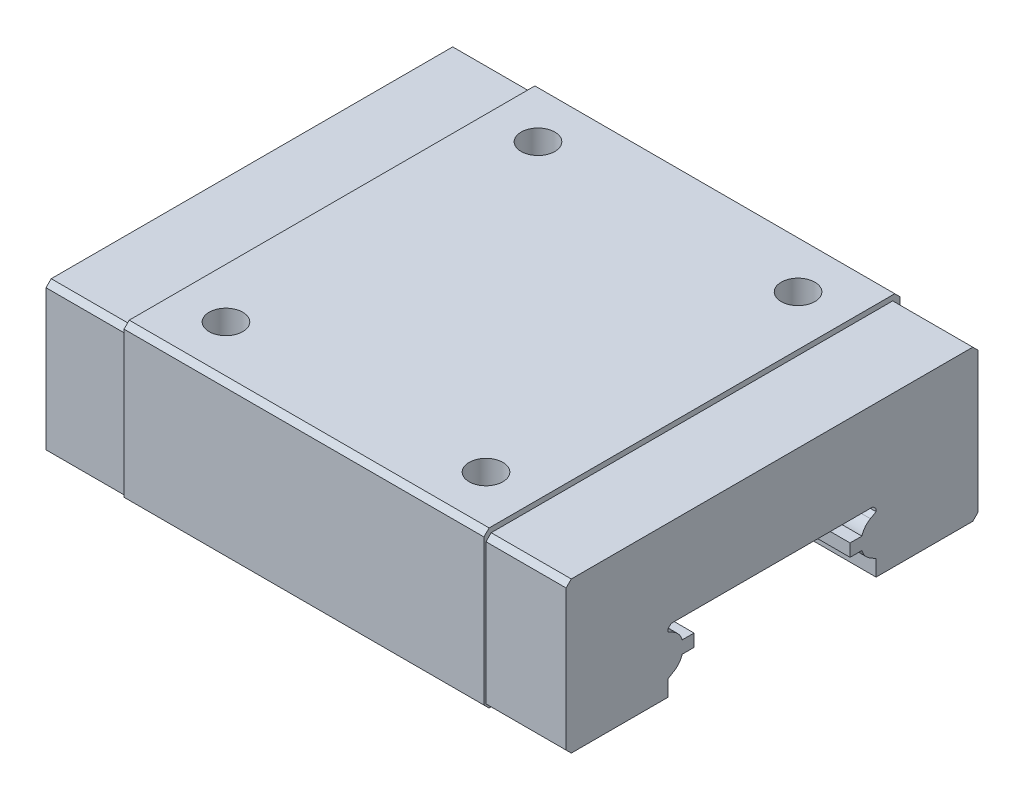
from build123d import *

# Parameters (mm, degrees)
SKETCH1_W               = 39.6
SKETCH1_H               = 14.5
BOSS_EXTRUDE1_DEPTH     = 25
SKETCH2_W               = 40
SKETCH2_H               = 15
BOSS_EXTRUDE2_DEPTH     = 17.3
CUT_EXTRUDE2_DEPTH      = 38.749172176
CUT_EXTRUDE2_DEPTH_BACK = 38.749172176
CHAMFER1_SIZE           = 0.5
CHAMFER2_SIZE           = 0.5
CHAMFER3_SIZE           = 0.5
CHAMFER4_SIZE           = 0.5
LPATTERN2_COUNT         = 2
LPATTERN2_PITCH         = 25
LPATTERN2_COUNT_DIR2    = 2
LPATTERN2_PITCH_DIR2    = 30


with BuildPart() as part:
    # Sketch1 → Boss-Extrude1 (new, symmetric)
    with BuildSketch(Plane(origin=(0, 0, 0), x_dir=(0, 0, -1), z_dir=(1, 0, 0))):
        with Locations((0, 12.25)):
            Rectangle(SKETCH1_W, SKETCH1_H)
    extrude(amount=BOSS_EXTRUDE1_DEPTH, both=True)

    # Sketch2 → Boss-Extrude2 (add, symmetric)
    with BuildSketch(Plane(origin=(0, 0, 0), x_dir=(0, 0, -1), z_dir=(1, 0, 0))):
        with Locations((0, 12.5)):
            Rectangle(SKETCH2_W, SKETCH2_H)
    extrude(amount=BOSS_EXTRUDE2_DEPTH, both=True)

    # Sketch4 → Cut-Extrude2 (cut, two sides: drawn at the far end of the back side and taken through both)
    with BuildSketch(Plane(origin=(0, 0, 0), x_dir=(0, 0, -1), z_dir=(1, 0, 0)).offset(-CUT_EXTRUDE2_DEPTH_BACK)):
        with BuildLine():
            Line((-9.7, 11), (9.7, 11))
            Line((9.7, 11), (10, 10.7))
            Line((10, 10.7), (10, 10.451039482))
            Line((10, 10.451039482), (9.455259378, 10.141421591))
            ThreePointArc((9.455259378, 10.141421591), (8.943868436, 9.701092928), (8.637115571, 9.1))
            Line((8.637115571, 9.1), (7.5, 9.1))
            Line((7.5, 9.1), (7.5, 7.9))
            Line((7.5, 7.9), (8.64, 7.9))
            ThreePointArc((8.64, 7.9), (8.939788863, 7.314120259), (9.434780564, 6.880401858))
            Line((9.434780564, 6.880401858), (10, 6.548960518))
            Line((10, 6.548960518), (10, 0))
            Line((10, 0), (-10, 0))
            Line((-10, 0), (-10, 6.548960518))
            Line((-10, 6.548960518), (-9.434780564, 6.880401858))
            ThreePointArc((-9.434780564, 6.880401858), (-8.939788863, 7.314120259), (-8.64, 7.9))
            Line((-8.64, 7.9), (-7.5, 7.9))
            Line((-7.5, 7.9), (-7.5, 9.1))
            Line((-7.5, 9.1), (-8.637115571, 9.1))
            ThreePointArc((-8.637115571, 9.1), (-8.943868436, 9.701092928), (-9.455259378, 10.141421591))
            Line((-9.455259378, 10.141421591), (-10, 10.451039482))
            Line((-10, 10.451039482), (-10, 10.7))
            Line((-10, 10.7), (-9.7, 11))
        make_face()
    extrude(amount=CUT_EXTRUDE2_DEPTH + CUT_EXTRUDE2_DEPTH_BACK, mode=Mode.SUBTRACT)

    # Chamfer1
    chamfer1_edges = [part.edges().sort_by_distance(p)[0] for p in [
        (-21.15, 19.5, 19.8),
        (-21.15, 19.5, -19.8),
        (21.15, 19.5, 19.8),
        (21.15, 19.5, -19.8),
    ]]
    chamfer(chamfer1_edges, length=CHAMFER1_SIZE)

    # Chamfer2
    chamfer2_edges = [part.edges().sort_by_distance(p)[0] for p in [
        (0, 20, 20),
        (0, 20, -20),
    ]]
    chamfer(chamfer2_edges, length=CHAMFER2_SIZE)

    # Chamfer3
    chamfer3_edges = [part.edges().sort_by_distance(p)[0] for p in [
        (-21.15, 5, -19.8),
        (-21.15, 5, 19.8),
        (21.15, 5, -19.8),
        (21.15, 5, 19.8),
    ]]
    chamfer(chamfer3_edges, length=CHAMFER3_SIZE)

    # Chamfer4
    chamfer4_edges = [part.edges().sort_by_distance(p)[0] for p in [
        (0, 5, 20),
        (0, 5, -20),
    ]]
    chamfer(chamfer4_edges, length=CHAMFER4_SIZE)

    # Sketch7 → Tap2 (revolve, cut)
    with BuildSketch(Plane(origin=(-12.5, 20, -15), x_dir=(0, 0, 1), z_dir=(1, 0, 0))):
        Polygon((0, 0), (0, 8.373995063), (1.621, 7.4), (1.621, 0), align=None)
    tap2 = revolve(axis=Axis((-12.5, 20, -15), (0, -1, 0)), mode=Mode.SUBTRACT)

    # LPattern2: Tap2 2 × 2
    with Locations(*[(i * LPATTERN2_PITCH, 0, j * LPATTERN2_PITCH_DIR2) for i in range(LPATTERN2_COUNT) for j in range(LPATTERN2_COUNT_DIR2) if (i, j) != (0, 0)]):
        add(tap2, mode=Mode.SUBTRACT)


solid = part.part
